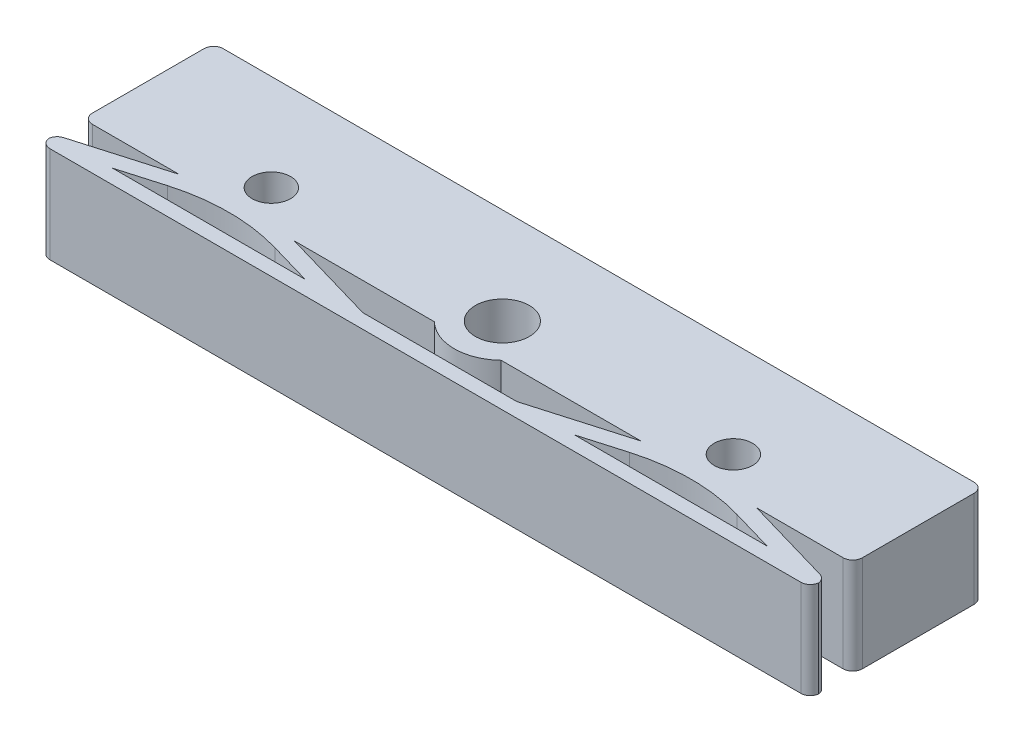
from build123d import *

# Parameters (mm, degrees)
SKETCH1_W               = 40
SKETCH1_H               = 9
BOSS_EXTRUDE1_DEPTH     = 5
CUT_EXTRUDE1_DEPTH      = 5
CUT_EXTRUDE1_DEPTH_BACK = 10
SKETCH2_R               = 1
SKETCH2_R_2             = 1.4
FILLET1_R               = 10
FILLET2_R               = 0.5
SKETCH3_R               = 1.5
CUT_EXTRUDE6_DEPTH      = 3.8
SKETCH4_W               = 3
SKETCH4_H               = 0.5
CUT_EXTRUDE7_DEPTH      = 2.5


with BuildPart() as part:
    # Sketch1 → Boss-Extrude1 (new body)
    with BuildSketch(Plane(origin=(0, 0, 0), x_dir=(1, 0, 0), z_dir=(0, 1, 0))):
        with Locations((20, 4.5)):
            Rectangle(SKETCH1_W, SKETCH1_H)
    extrude(amount=BOSS_EXTRUDE1_DEPTH)

    # Sketch2 → Cut-Extrude1 (cut, two sides: drawn at the far end of the back side and taken through both)
    with BuildSketch(Plane(origin=(0, 5, 0), x_dir=(1, 0, 0), z_dir=(0, 1, 0)).offset(-CUT_EXTRUDE1_DEPTH_BACK)):
        with Locations(Location((8, 4, 0), (0, 0, 90))):
            Circle(SKETCH2_R)
        with Locations(Location((32, 4, 0), (0, 0, 90))):
            Circle(SKETCH2_R)
        with Locations(Location((20, 4, 0), (0, 0, 90))):
            Circle(SKETCH2_R_2)
        with BuildLine():
            ThreePointArc((21.734935157, 2.2), (20, 1.5), (18.265064843, 2.2))
            Line((18.265064843, 2.2), (11, 2.2))
            Line((11, 2.2), (16, 0.75))
            Line((16, 0.75), (24, 0.75))
            Line((24, 0.75), (29, 2.2))
            Line((29, 2.2), (21.734935157, 2.2))
        make_face()
        Polygon((13, 0.75), (8, 2.2), (3, 0.75), align=None)
        Polygon((37, 0.75), (32, 2.2), (27, 0.75), align=None)
        Polygon((0, 0.75), (5, 2.2), (0, 2.2), align=None)
        Polygon((40, 2.2), (35, 2.2), (40, 0.75), align=None)
    extrude(amount=CUT_EXTRUDE1_DEPTH + CUT_EXTRUDE1_DEPTH_BACK, mode=Mode.SUBTRACT)

    # Fillet1
    fillet1_edges = [part.edges().sort_by_distance(p)[0] for p in [
        (32, 2.5, -2.2),
        (8, 2.5, -2.2),
    ]]
    fillet(fillet1_edges, radius=FILLET1_R)

    # Fillet2
    # the kernel refuses this fillet: 0.5 mm, written as the material it adds along each edge
    with BuildSketch(Plane(origin=(24, 5, -0.75), x_dir=(0.9604291387787307, 0, -0.27852445024583705), z_dir=(0, -1, 0))) as fillet2_piece_1:
        with BuildLine():
            CenterArc((FILLET2_R * 0.142073204655, -FILLET2_R), FILLET2_R, 90, 16.172159016)
            Line((-FILLET2_R * 0.136451245591, -FILLET2_R * 0.0395708612213), (0, 0))
            Line((0, 0), (FILLET2_R * 0.142073204655, 0))
        make_face()
    extrude(amount=5)
    with BuildSketch(Plane(origin=(16, 0, -0.75), x_dir=(1, 0, 0), z_dir=(0, 1, 0))) as fillet2_piece_2:
        with BuildLine():
            CenterArc((FILLET2_R * 0.142073204655, FILLET2_R), FILLET2_R, 253.827840984, 16.172159016)
            Line((-FILLET2_R * 0.136451245591, FILLET2_R * 0.0395708612213), (0, 0))
            Line((0, 0), (FILLET2_R * 0.142073204655, 0))
        make_face()
    extrude(amount=5)
    # the kernel refuses this fillet: 0.5 mm, written as the material it takes off along each edge
    with BuildSketch(Plane(origin=(0, 5.939001537, -0.75), x_dir=(0.960429138778732, 0, -0.2785244502458324), z_dir=(0, -1, 0)), Plane(origin=(40, 5.939001537, -0.75), x_dir=(0, 0, 1), z_dir=(0, -1, 0))) as fillet2_2_piece_1:
        with BuildLine():
            CenterArc((FILLET2_R * 0.75120122935, FILLET2_R), FILLET2_R, 196.172159016, 73.827840984)
            Line((-FILLET2_R * 0.209227909429, FILLET2_R * 0.721475549754), (0, 0))
            Line((0, 0), (FILLET2_R * 0.75120122935, 0))
        make_face()
    extrude(amount=6.878003073, mode=Mode.SUBTRACT)
    with BuildSketch(Plane(origin=(0, 6.25, -2.2), x_dir=(0, 0, -1), z_dir=(0, -1, 0)), Plane(origin=(40, 6.25, -2.2), x_dir=(-1, 0, 0), z_dir=(0, -1, 0)), Plane(origin=(0, -1.25, 0), x_dir=(1, 0, 0), z_dir=(0, 1, 0))) as fillet2_2_piece_2:
        with BuildLine():
            CenterArc((FILLET2_R, FILLET2_R), FILLET2_R, 180, 90)
            Line((0, FILLET2_R), (0, 0))
            Line((0, 0), (FILLET2_R, 0))
        make_face()
    extrude(amount=7.5, mode=Mode.SUBTRACT)
    with BuildSketch(Plane(origin=(0, -1.25, -9), x_dir=(1, 0, 0), z_dir=(0, 1, 0)), Plane(origin=(40, -1.25, -9), x_dir=(0, 0, 1), z_dir=(0, 1, 0)), Plane(origin=(40, -1.25, 0), x_dir=(-1, 0, 0), z_dir=(0, 1, 0))) as fillet2_2_piece_3:
        with BuildLine():
            CenterArc((FILLET2_R, -FILLET2_R), FILLET2_R, 90, 90)
            Line((0, -FILLET2_R), (0, 0))
            Line((0, 0), (FILLET2_R, 0))
        make_face()
    extrude(amount=7.5, mode=Mode.SUBTRACT)

    # Sketch3 → Cut-Extrude6 (cut)
    with BuildSketch(Plane(origin=(0, 0, -9), x_dir=(-1, 0, 0), z_dir=(0, 0, -1))):
        with Locations((-32, 3)):
            Circle(SKETCH3_R)
        with Locations((-8, 3)):
            Circle(SKETCH3_R)
    extrude(amount=-CUT_EXTRUDE6_DEPTH, mode=Mode.SUBTRACT)

    # Sketch4 → Cut-Extrude7 (cut)
    with BuildSketch(Plane(origin=(0, 0, -5.2), x_dir=(-1, 0, 0), z_dir=(0, 0, -1))):
        with Locations((-32, 3)):
            Rectangle(SKETCH4_W, SKETCH4_H)
        with Locations((-8, 3)):
            Rectangle(SKETCH4_W, SKETCH4_H)
    extrude(amount=-CUT_EXTRUDE7_DEPTH, mode=Mode.SUBTRACT)


solid = part.part
